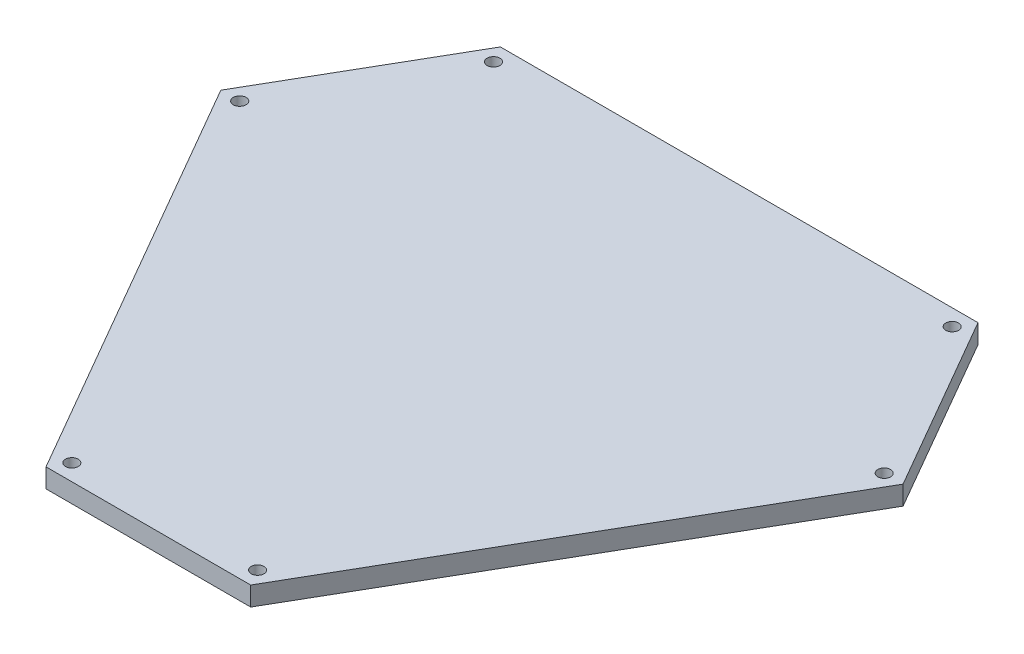
from build123d import *

# Parameters (mm, degrees)
BOSS_EXTRUDE1_DEPTH = 7
SKETCH2_R           = 2.35
CUT_EXTRUDE1_DEPTH  = 4


with BuildPart() as part:
    # Sketch1 → Boss-Extrude1 (new body)
    with BuildSketch(Plane(origin=(0, 0, 0), x_dir=(1, 0, 0), z_dir=(0, 1, 0))):
        Polygon((87.5, 93.819418743), (-87.5, 93.819418743), (-125, 28.867513459), (-37.5, -122.686932203), (37.5, -122.686932203), (125, 28.867513459), align=None)
    extrude(amount=BOSS_EXTRUDE1_DEPTH)

    # Sketch2 → Cut-Extrude1 (cut)
    with BuildSketch(Plane(origin=(0, 7, 0), x_dir=(1, 0, 0), z_dir=(0, 1, 0))):
        with Locations((118.07179677, 28.867513459)):
            Circle(SKETCH2_R)
        with Locations((84.035898385, 87.819418743)):
            Circle(SKETCH2_R)
        with Locations((-84.035898385, 87.819418743)):
            Circle(SKETCH2_R)
        with Locations((-118.07179677, 28.867513459)):
            Circle(SKETCH2_R)
        with Locations((-34.035898385, -116.686932203)):
            Circle(SKETCH2_R)
        with Locations((34.035898385, -116.686932203)):
            Circle(SKETCH2_R)
    extrude(amount=-CUT_EXTRUDE1_DEPTH, mode=Mode.SUBTRACT)


solid = part.part
